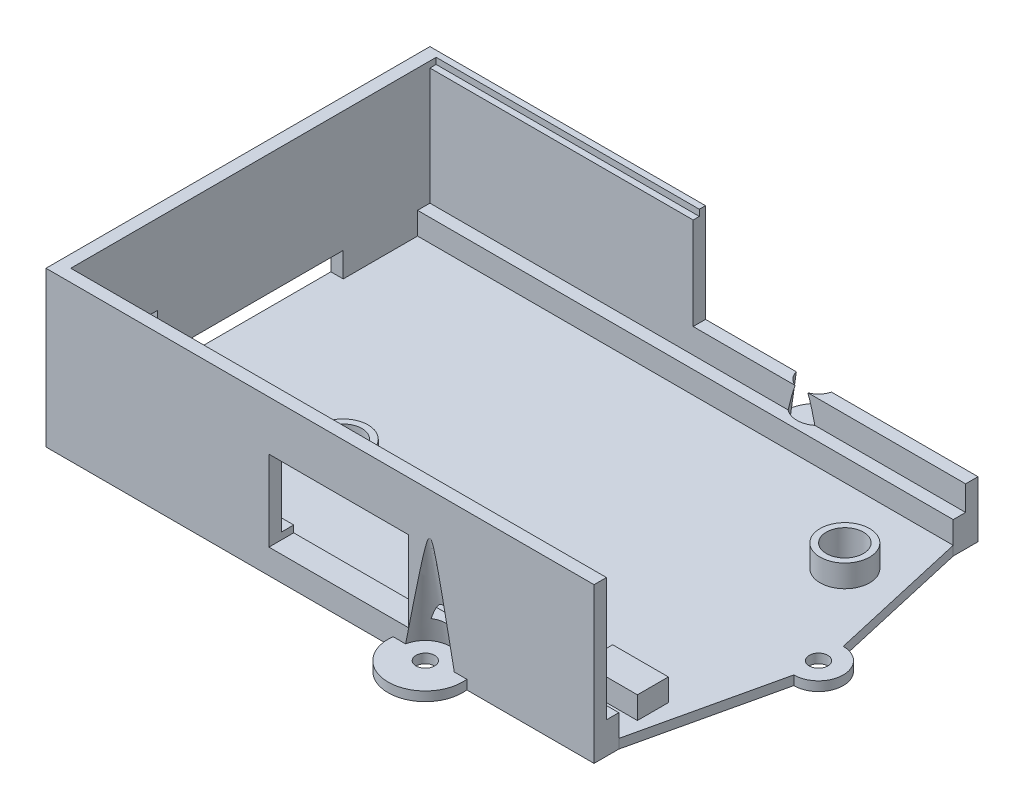
from build123d import *

# Parameters (mm, degrees)
SKETCH2_W           = 88.5
SKETCH2_H           = 62
BOSS_EXTRUDE1_DEPTH = 25
SKETCH3_W           = 86.5
SKETCH3_H           = 58
CUT_EXTRUDE1_DEPTH  = 19.9
SKETCH8_W           = 86.5
SKETCH8_H           = 54
CUT_EXTRUDE4_DEPTH  = 3.6
SKETCH9_W           = 44
SKETCH9_H           = 28.236774976
CUT_EXTRUDE5_DEPTH  = 110.80550988
SKETCH10_W          = 13
SKETCH10_H          = 7
CUT_EXTRUDE6_DEPTH  = 110.321772763
SKETCH11_W          = 26
SKETCH11_H          = 4
CUT_EXTRUDE7_DEPTH  = 110.321772763
SKETCH12_W          = 22.5
SKETCH12_H          = 13
CUT_EXTRUDE9_DEPTH  = 110.80550988
SKETCH18_W          = 22.5
SKETCH18_H          = 1.1
CUT_EXTRUDE10_DEPTH = 3.6
SKETCH19_R          = 4
SKETCH19_W          = 9
SKETCH19_H          = 5
BOSS_EXTRUDE2_DEPTH = 3.6
SKETCH20_R          = 3
CUT_EXTRUDE11_DEPTH = 110.87383674
SKETCH21_R          = 3
CUT_EXTRUDE13_DEPTH = 110.87383674
SKETCH22_R          = 4
CUT_EXTRUDE15_DEPTH = 11.6
CUT_EXTRUDE15_TAPER = 8
SKETCH22_7_R        = 4
BOSS_EXTRUDE3_DEPTH = 1.5
BOSS_EXTRUDE6_DEPTH = 1.5
CUT_EXTRUDE20_DEPTH = 111.582548352
SKETCH22_9_R        = 6
BOSS_EXTRUDE7_DEPTH = 1.5
SKETCH22_10_R       = 1.5
CUT_EXTRUDE21_DEPTH = 1
SKETCH22_11_R       = 1.5
BOSS_EXTRUDE8_DEPTH = 1.5
SKETCH26_W          = 42.5
SKETCH26_H          = 1
CUT_EXTRUDE22_DEPTH = 1


with BuildPart() as part:
    # Sketch2 → Boss-Extrude1 (new body)
    with BuildSketch(Plane(origin=(0, 0, 0), x_dir=(1, 0, 0), z_dir=(0, 1, 0))):
        with Locations((44.25, 31)):
            Rectangle(SKETCH2_W, SKETCH2_H)
    extrude(amount=BOSS_EXTRUDE1_DEPTH)

    # Sketch3 → Cut-Extrude1 (cut)
    with BuildSketch(Plane(origin=(0, 25, 0), x_dir=(1, 0, 0), z_dir=(0, 1, 0))):
        with Locations((45.25, 31)):
            Rectangle(SKETCH3_W, SKETCH3_H)
    extrude(amount=-CUT_EXTRUDE1_DEPTH, mode=Mode.SUBTRACT)

    # Sketch8 → Cut-Extrude4 (cut)
    with BuildSketch(Plane(origin=(0, 5.1, 0), x_dir=(1, 0, 0), z_dir=(0, 1, 0))):
        with Locations((45.25, 31)):
            Rectangle(SKETCH8_W, SKETCH8_H)
    extrude(amount=-CUT_EXTRUDE4_DEPTH, mode=Mode.SUBTRACT)

    # Sketch9 → Cut-Extrude5 (cut, through all)
    with BuildSketch(Plane.XY.offset(-60)):
        with Locations((66.5, 23.218387488)):
            Rectangle(SKETCH9_W, SKETCH9_H)
    extrude(amount=-CUT_EXTRUDE5_DEPTH, mode=Mode.SUBTRACT)

    # Sketch10 → Cut-Extrude6 (cut, through all)
    with BuildSketch(Plane(origin=(2, 0, 0), x_dir=(0, 0, -1), z_dir=(1, 0, 0))):
        with Locations((9.5, 8.6)):
            Rectangle(SKETCH10_W, SKETCH10_H)
    extrude(amount=-CUT_EXTRUDE6_DEPTH, mode=Mode.SUBTRACT)

    # Sketch11 → Cut-Extrude7 (cut, through all)
    with BuildSketch(Plane(origin=(2, 0, 0), x_dir=(0, 0, -1), z_dir=(1, 0, 0))):
        with Locations((33, 3.5)):
            Rectangle(SKETCH11_W, SKETCH11_H)
    extrude(amount=-CUT_EXTRUDE7_DEPTH, mode=Mode.SUBTRACT)

    # Sketch12 → Cut-Extrude9 (cut, through all)
    with BuildSketch(Plane(origin=(0, 0, -2), x_dir=(-1, 0, 0), z_dir=(0, 0, -1))):
        with Locations((-47.25, 10.5)):
            Rectangle(SKETCH12_W, SKETCH12_H)
    extrude(amount=-CUT_EXTRUDE9_DEPTH, mode=Mode.SUBTRACT)

    # Sketch18 → Cut-Extrude10 (cut)
    with BuildSketch(Plane.XY.offset(-2)):
        with Locations((47.25, 4.55)):
            Rectangle(SKETCH18_W, SKETCH18_H)
    extrude(amount=-CUT_EXTRUDE10_DEPTH, mode=Mode.SUBTRACT)

    # Sketch19 → Boss-Extrude2 (add)
    with BuildSketch(Plane(origin=(0, 1.5, 0), x_dir=(1, 0, 0), z_dir=(0, 1, 0))):
        with Locations((28, 20)):
            Circle(SKETCH19_R)
        with Locations((83, 46)):
            Circle(SKETCH19_R)
        with Locations((83, 10.5)):
            Rectangle(SKETCH19_W, SKETCH19_H)
    extrude(amount=BOSS_EXTRUDE2_DEPTH)

    # Sketch20 → Cut-Extrude11 (cut, through all)
    with BuildSketch(Plane(origin=(0, 5.1, 0), x_dir=(1, 0, 0), z_dir=(0, 1, 0))):
        with Locations((28, 20)):
            Circle(SKETCH20_R)
    extrude(amount=-CUT_EXTRUDE11_DEPTH, mode=Mode.SUBTRACT)

    # Sketch21 → Cut-Extrude13 (cut, through all)
    with BuildSketch(Plane(origin=(0, 5.1, 0), x_dir=(1, 0, 0), z_dir=(0, 1, 0))):
        with Locations((83, 46)):
            Circle(SKETCH21_R)
    extrude(amount=-CUT_EXTRUDE13_DEPTH, mode=Mode.SUBTRACT)

    # Sketch22 → Cut-Extrude15 (cut)
    with BuildSketch(Plane(origin=(0, 1.5, 0), x_dir=(1, 0, 0), z_dir=(0, 1, 0))):
        with Locations((62, 62.75)):
            Circle(SKETCH22_R)
    extrude(amount=CUT_EXTRUDE15_DEPTH, taper=CUT_EXTRUDE15_TAPER, mode=Mode.SUBTRACT)

    # Cut-Extrude18 cone 1 section (through the dimple's axis) → Cut-Extrude18 (revolve, cut)
    with BuildSketch(Plane(origin=(62, 1.5, 0.75), x_dir=(0, 0, -1), z_dir=(1, 0, 0))):
        Polygon((0, 0), (4, 0), (0, 20.578216064), align=None)
    revolve(axis=Axis((62, 1.5, 0.75), (0, 1, 0)), mode=Mode.SUBTRACT)

    # Sketch22<7> → Boss-Extrude3 (add)
    with BuildSketch(Plane(origin=(0, 1.5, 0), x_dir=(1, 0, 0), z_dir=(0, 1, 0))):
        with Locations((62, -0.75)):
            Circle(SKETCH22_7_R)
    extrude(amount=-BOSS_EXTRUDE3_DEPTH)

    # Sketch23 → Boss-Extrude6 (add)
    with BuildSketch(Plane(origin=(0, 1.5, 0), x_dir=(1, 0, 0), z_dir=(0, 1, 0))):
        with BuildLine():
            ThreePointArc((67.893587617, 0.375), (62, 5.25), (56.106412383, 0.375))
            ThreePointArc((56.106412383, 0.375), (62, -6.75), (67.893587617, 0.375))
        make_face()
    extrude(amount=-BOSS_EXTRUDE6_DEPTH)

    # Sketch25 → Cut-Extrude20 (cut, through all)
    with BuildSketch(Plane(origin=(0, 1.5, 0), x_dir=(1, 0, 0), z_dir=(0, 1, 0))):
        with BuildLine():
            ThreePointArc((63.473396904, -0.46875), (62, 0.75), (60.526603096, -0.46875))
            ThreePointArc((60.526603096, -0.46875), (62, -2.25), (63.473396904, -0.46875))
        make_face()
    extrude(amount=-CUT_EXTRUDE20_DEPTH, mode=Mode.SUBTRACT)

    # Sketch22<9> → Boss-Extrude7 (add)
    with BuildSketch(Plane(origin=(0, 1.5, 0), x_dir=(1, 0, 0), z_dir=(0, 1, 0))):
        with Locations((62, 62.75)):
            Circle(SKETCH22_9_R)
    extrude(amount=-BOSS_EXTRUDE7_DEPTH)

    # Sketch22<10> → Cut-Extrude21 (cut)
    with BuildSketch(Plane(origin=(0, 1.5, 0), x_dir=(1, 0, 0), z_dir=(0, 1, 0))):
        with Locations((62, 62.75)):
            Circle(SKETCH22_10_R)
    extrude(amount=-CUT_EXTRUDE21_DEPTH, mode=Mode.SUBTRACT)

    # Sketch22<11> → Boss-Extrude8 (add)
    with BuildSketch(Plane(origin=(0, 1.5, 0), x_dir=(1, 0, 0), z_dir=(0, 1, 0))):
        with BuildLine():
            Line((93.748188925, 35), (88.5, 58))
            Line((88.5, 58), (88.5, 4))
            Line((88.5, 4), (93.748188925, 27))
            ThreePointArc((93.748188925, 27), (97.748188925, 31), (93.748188925, 35))
        make_face()
        with Locations((93.748188925, 31)):
            Circle(SKETCH22_11_R, mode=Mode.SUBTRACT)
    extrude(amount=-BOSS_EXTRUDE8_DEPTH)

    # Sketch26 → Cut-Extrude22 (cut)
    with BuildSketch(Plane(origin=(0, 25, 0), x_dir=(1, 0, 0), z_dir=(0, 1, 0))):
        with Locations((23.25, 60.5)):
            Rectangle(SKETCH26_W, SKETCH26_H)
    extrude(amount=-CUT_EXTRUDE22_DEPTH, mode=Mode.SUBTRACT)


solid = part.part
